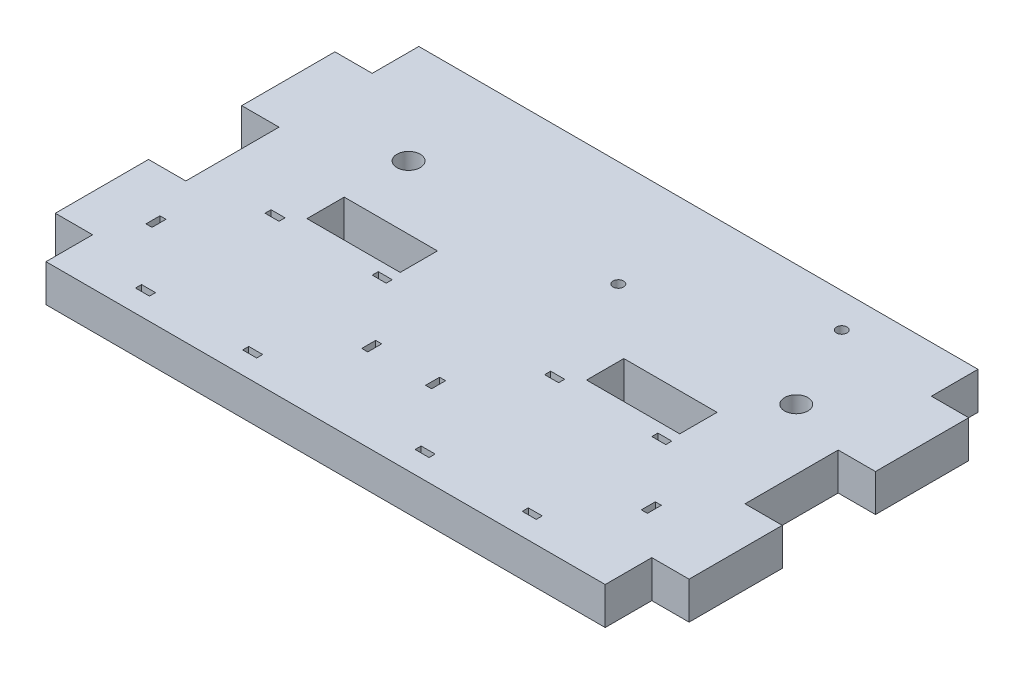
from build123d import *

# Parameters (mm, degrees)
SKETCH1_W           = 120
SKETCH1_H           = 80
SKETCH1_R           = 2.5
SKETCH1_R_2         = 1.13
SKETCH1_W_2         = 3
SKETCH1_H_2         = 1.3
SKETCH1_W_3         = 1.3
SKETCH1_H_3         = 3
BOSS_EXTRUDE1_DEPTH = 8
CUT_EXTRUDE1_DEPTH  = 4
CUT_EXTRUDE2_REACH  = 74.553
SKETCH3_W           = 20
SKETCH3_H           = 8
SKETCH4_W           = 20
SKETCH4_H           = 8
BOSS_EXTRUDE2_DEPTH = 8


with BuildPart() as part:
    # Sketch1 → Boss-Extrude1 (new body)
    with BuildSketch(Plane(origin=(0, 0, 0), x_dir=(1, 0, 0), z_dir=(0, 1, 0))):
        Rectangle(SKETCH1_W, SKETCH1_H)
        with Locations((-39.823045535, 17.627318551)):
            Circle(SKETCH1_R, mode=Mode.SUBTRACT)
        with Locations((47, 14)):
            Circle(SKETCH1_R, mode=Mode.SUBTRACT)
        with Locations((38.07, 32.68)):
            Circle(SKETCH1_R_2, mode=Mode.SUBTRACT)
        with Locations((5.56, 17.26)):
            Circle(SKETCH1_R_2, mode=Mode.SUBTRACT)
        with Locations((16, -34.65)):
            Rectangle(SKETCH1_W_2, SKETCH1_H_2, mode=Mode.SUBTRACT)
        with Locations((16, -6.85)):
            Rectangle(SKETCH1_W_2, SKETCH1_H_2, mode=Mode.SUBTRACT)
        with Locations((39, -6.85)):
            Rectangle(SKETCH1_W_2, SKETCH1_H_2, mode=Mode.SUBTRACT)
        with Locations((39, -34.65)):
            Rectangle(SKETCH1_W_2, SKETCH1_H_2, mode=Mode.SUBTRACT)
        with Locations((50.65, -20.75)):
            Rectangle(SKETCH1_W_3, SKETCH1_H_3, mode=Mode.SUBTRACT)
        with Locations((4.35, -20.75)):
            Rectangle(SKETCH1_W_3, SKETCH1_H_3, mode=Mode.SUBTRACT)
        with Locations((-55.65, -20.75)):
            Rectangle(SKETCH1_W_3, SKETCH1_H_3, mode=Mode.SUBTRACT)
        with Locations((-9.35, -20.75)):
            Rectangle(SKETCH1_W_3, SKETCH1_H_3, mode=Mode.SUBTRACT)
        with Locations((-44, -34.65)):
            Rectangle(SKETCH1_W_2, SKETCH1_H_2, mode=Mode.SUBTRACT)
        with Locations((-44, -6.85)):
            Rectangle(SKETCH1_W_2, SKETCH1_H_2, mode=Mode.SUBTRACT)
        with Locations((-21, -34.65)):
            Rectangle(SKETCH1_W_2, SKETCH1_H_2, mode=Mode.SUBTRACT)
        with Locations((-21, -6.85)):
            Rectangle(SKETCH1_W_2, SKETCH1_H_2, mode=Mode.SUBTRACT)
    extrude(amount=BOSS_EXTRUDE1_DEPTH)

    # Sketch2 → Cut-Extrude1 (cut)
    with BuildSketch(Plane.XZ):
        Polygon((7.869401077, -17.26), (6.714700538, -15.26), (4.405299462, -15.26), (3.250598923, -17.26), (4.405299462, -19.26), (6.714700538, -19.26), align=None)
        Polygon((40.379401077, -32.68), (39.224700538, -30.68), (36.915299462, -30.68), (35.760598923, -32.68), (36.915299462, -34.68), (39.224700538, -34.68), align=None)
    extrude(amount=-CUT_EXTRUDE1_DEPTH, mode=Mode.SUBTRACT)

    # Sketch3 → Cut-Extrude2 (cut, up to next)
    with BuildSketch(Plane.XZ, mode=Mode.PRIVATE) as cut_extrude2_sk1:
        with Locations((-30, 0)):
            Rectangle(SKETCH3_W, SKETCH3_H)
    cut_extrude2_tool1 = extrude(cut_extrude2_sk1.sketch, amount=-CUT_EXTRUDE2_REACH, mode=Mode.PRIVATE) & part.part
    cut_extrude2 = cut_extrude2_tool1.solids().sort_by_distance((-30, 0, 0))[0]
    add(cut_extrude2, mode=Mode.SUBTRACT)

    # Mirror1: Cut-Extrude2 across plane
    add(cut_extrude2.mirror(Plane.ZY), mode=Mode.SUBTRACT)

    # Sketch4 → Boss-Extrude2 (add)
    with BuildSketch(Plane.ZY.offset(60)):
        with Locations((20, 4)):
            Rectangle(SKETCH4_W, SKETCH4_H)
        with Locations((-20, 4)):
            Rectangle(SKETCH4_W, SKETCH4_H)
    boss_extrude2 = extrude(amount=BOSS_EXTRUDE2_DEPTH)

    # Mirror2: Boss-Extrude2 across plane
    add(boss_extrude2.mirror(Plane.ZY))


solid = part.part
